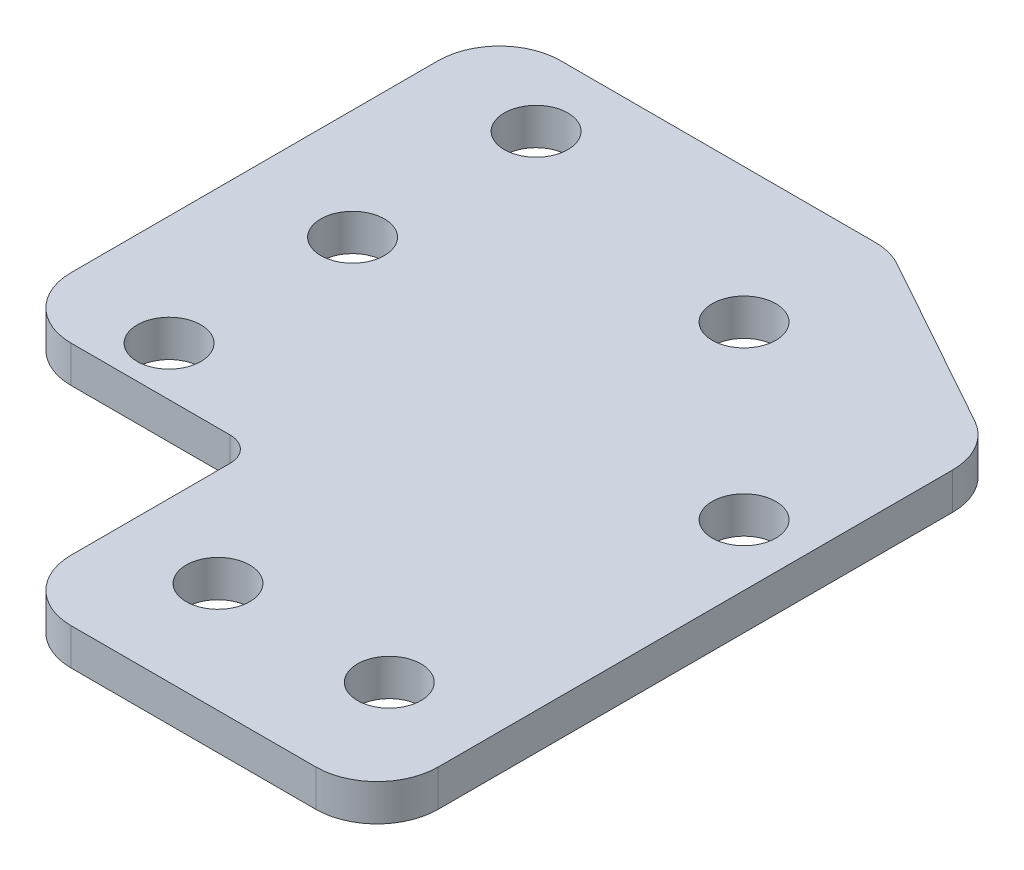
from build123d import *

# Parameters (mm, degrees)
SKETCH2_R          = 2.6
BASE_FLANGE1_DEPTH = 3
FILLET1_R          = 5
SKETCH3_R          = 2.6
CUT_EXTRUDE1_DEPTH = 10
FILLET2_R          = 2


# Sheet-metal steps are written as plain solids
with BuildPart() as part:
    # Sketch2 → Base-Flange1 (new body)
    with BuildSketch(Plane(origin=(0, 0, 0), x_dir=(1, 0, 0), z_dir=(0, 1, 0))):
        Polygon((0, 60), (32, 60), (50, 50), (50, 0), (20, 0), (20, 20), (0, 20), align=None)
        with Locations(Location((9, 39, 0), (0, 0, 270))):
            Circle(SKETCH2_R, mode=Mode.SUBTRACT)
        with Locations(Location((9, 24, 0), (0, 0, 270))):
            Circle(SKETCH2_R, mode=Mode.SUBTRACT)
        with Locations(Location((28, 9, 0), (0, 0, 270))):
            Circle(SKETCH2_R, mode=Mode.SUBTRACT)
        with Locations(Location((42, 9, 0), (0, 0, 270))):
            Circle(SKETCH2_R, mode=Mode.SUBTRACT)
        with Locations(Location((9, 54, 0), (0, 0, 270))):
            Circle(SKETCH2_R, mode=Mode.SUBTRACT)
    extrude(amount=-BASE_FLANGE1_DEPTH)

    # Fillet1
    fillet1_edges = [part.edges().sort_by_distance(p)[0] for p in [
        (0, -1.5, -20),
        (0, -1.5, -60),
        (32, -1.5, -60),
        (50, -1.5, -50),
        (50, -1.5, 0),
        (20, -1.5, 0),
    ]]
    fillet(fillet1_edges, radius=FILLET1_R)

    # Sketch3 → Cut-Extrude1 (cut)
    with BuildSketch(Plane(origin=(0, 0, 0), x_dir=(1, 0, 0), z_dir=(0, 1, 0))):
        with Locations(Location((45, 35, 0), (0, 0, 270))):
            Circle(SKETCH3_R)
        with Locations(Location((31, 49, 0), (0, 0, 270))):
            Circle(SKETCH3_R)
    extrude(amount=-CUT_EXTRUDE1_DEPTH, mode=Mode.SUBTRACT)

    # Fillet2
    fillet2_edges = [part.edges().sort_by_distance(p)[0] for p in [
        (20, -1.5, -20),
    ]]
    fillet(fillet2_edges, radius=FILLET2_R)


solid = part.part
